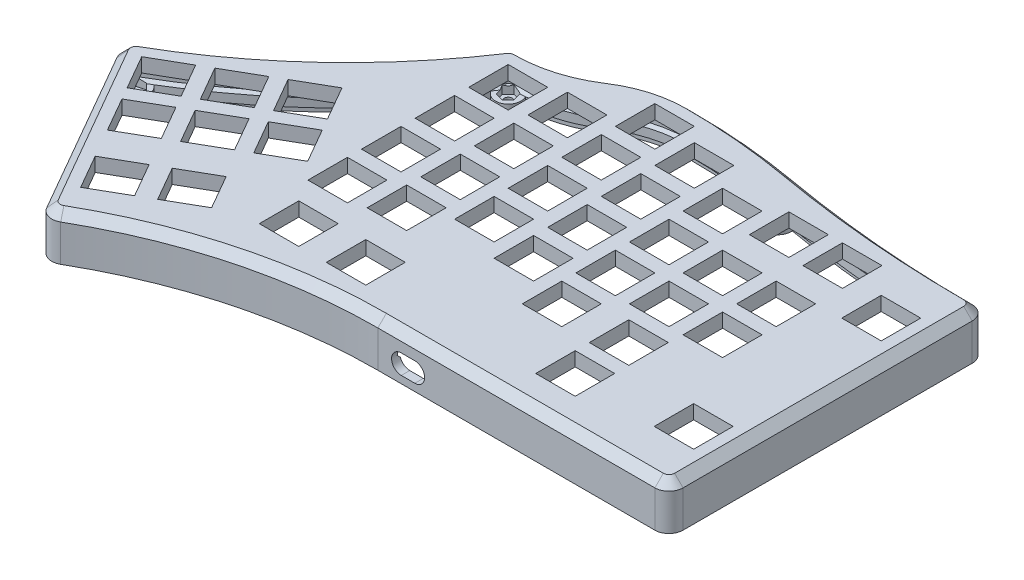
from build123d import *

# Parameters (mm, degrees)
SKETCH3_W                = 14
SKETCH3_H                = 14
MAIN_PLATE_DEPTH         = 5
MAIN_PLATE_CHAMFER_SIZE  = 3
WALL_DEPTH               = 11
NICE_NANO_RECESS_DEPTH   = 2
MAIN_SWITCH_RECESS_DEPTH = 2
SIDE_START               = -3
SIDE_DEPTH               = 3
FASTENERS_START          = -3
SKETCH8_R                = 1.35
FASTENERS_DEPTH          = 3
CHAMFER1_SIZE            = 1
NUT_SOCCETS_DEPTH        = 2
CHARGE_SOCCET_DEPTH      = 5
SKETCH11_R               = 3
MAGNET01_DEPTH           = 1.5
SKETCH10_R               = 3
MAGNET02_DEPTH           = 1.5


with BuildPart() as part:
    # Sketch3 → Main_plate (new body)
    with BuildSketch(Plane(origin=(0, 0, 0), x_dir=(1, 0, 0), z_dir=(0, 1, 0))):
        with BuildLine():
            Line((160, 22.5), (160, -80))
            ThreePointArc((160, -80), (158.535533906, -83.535533906), (155, -85))
            Line((155, -85), (56.796090657, -85))
            ThreePointArc((56.796090657, -85), (10.868246694, -91.025346783), (-31.951197412, -108.693591219))
            ThreePointArc((-31.951197412, -108.693591219), (-35.746191671, -109.186216339), (-38.77799641, -106.851088727))
            Line((-38.77799641, -106.851088727), (-72.421997828, -48.333303664))
            ThreePointArc((-72.421997828, -48.333303664), (-72.914622948, -44.538309405), (-70.579495335, -41.506504666))
            ThreePointArc((-70.579495335, -41.506504666), (-33.753261114, -14.230305993), (-4.165423102, 20.765727822))
            ThreePointArc((-4.165423102, 20.765727822), (-2.363404419, 22.406168353), (0, 23))
            ThreePointArc((0, 23), (12.260199835, 24.787186267), (23.5, 30))
            ThreePointArc((23.5, 30), (34.739800165, 35.212813733), (47, 37))
            ThreePointArc((47, 37), (66.073364447, 36.162741622), (85, 33.657407407))
            ThreePointArc((85, 33.657407407), (119.864854967, 29.042318065), (155, 27.5))
            ThreePointArc((155, 27.5), (158.535533906, 26.035533906), (160, 22.5))
        make_face()
        with Locations((104, 13.5)):
            Rectangle(SKETCH3_W, SKETCH3_H, mode=Mode.SUBTRACT)
        Polygon((-65.356627483, -46.578156408), (-53.219605396, -39.600141299), (-46.241590287, -51.737163386), (-58.378612374, -58.715178495), align=None, mode=Mode.SUBTRACT)
        with Locations((9, -10)):
            Rectangle(SKETCH3_W, SKETCH3_H, mode=Mode.SUBTRACT)
        with Locations((9, 9)):
            Rectangle(SKETCH3_W, SKETCH3_H, mode=Mode.SUBTRACT)
        with Locations((28, 11)):
            Rectangle(SKETCH3_W, SKETCH3_H, mode=Mode.SUBTRACT)
        with Locations((47, 23)):
            Rectangle(SKETCH3_W, SKETCH3_H, mode=Mode.SUBTRACT)
        with Locations((66, 18)):
            Rectangle(SKETCH3_W, SKETCH3_H, mode=Mode.SUBTRACT)
        with Locations((85, 9)):
            Rectangle(SKETCH3_W, SKETCH3_H, mode=Mode.SUBTRACT)
        with Locations((104, -10)):
            Rectangle(SKETCH3_W, SKETCH3_H, mode=Mode.SUBTRACT)
        with Locations((123, -10)):
            Rectangle(SKETCH3_W, SKETCH3_H, mode=Mode.SUBTRACT)
        with Locations((146, 4.25)):
            Rectangle(SKETCH3_W, SKETCH3_H, mode=Mode.SUBTRACT)
        with Locations((146, -62.25)):
            Rectangle(SKETCH3_W, SKETCH3_H, mode=Mode.SUBTRACT)
        with Locations((28, -8)):
            Rectangle(SKETCH3_W, SKETCH3_H, mode=Mode.SUBTRACT)
        with Locations((47, 4)):
            Rectangle(SKETCH3_W, SKETCH3_H, mode=Mode.SUBTRACT)
        with Locations((66, -1)):
            Rectangle(SKETCH3_W, SKETCH3_H, mode=Mode.SUBTRACT)
        with Locations((85, -10)):
            Rectangle(SKETCH3_W, SKETCH3_H, mode=Mode.SUBTRACT)
        with Locations((104, -29)):
            Rectangle(SKETCH3_W, SKETCH3_H, mode=Mode.SUBTRACT)
        with Locations((123, -29)):
            Rectangle(SKETCH3_W, SKETCH3_H, mode=Mode.SUBTRACT)
        with Locations((9, -29)):
            Rectangle(SKETCH3_W, SKETCH3_H, mode=Mode.SUBTRACT)
        with Locations((28, -27)):
            Rectangle(SKETCH3_W, SKETCH3_H, mode=Mode.SUBTRACT)
        with Locations((47, -15)):
            Rectangle(SKETCH3_W, SKETCH3_H, mode=Mode.SUBTRACT)
        with Locations((66, -20)):
            Rectangle(SKETCH3_W, SKETCH3_H, mode=Mode.SUBTRACT)
        with Locations((85, -29)):
            Rectangle(SKETCH3_W, SKETCH3_H, mode=Mode.SUBTRACT)
        with Locations((9, -48)):
            Rectangle(SKETCH3_W, SKETCH3_H, mode=Mode.SUBTRACT)
        with Locations((28, -46)):
            Rectangle(SKETCH3_W, SKETCH3_H, mode=Mode.SUBTRACT)
        with Locations((47, -34)):
            Rectangle(SKETCH3_W, SKETCH3_H, mode=Mode.SUBTRACT)
        with Locations((66, -39)):
            Rectangle(SKETCH3_W, SKETCH3_H, mode=Mode.SUBTRACT)
        with Locations((85, -48)):
            Rectangle(SKETCH3_W, SKETCH3_H, mode=Mode.SUBTRACT)
        with Locations((13.75, -70)):
            Rectangle(SKETCH3_W, SKETCH3_H, mode=Mode.SUBTRACT)
        with Locations((108.75, -67)):
            Rectangle(SKETCH3_W, SKETCH3_H, mode=Mode.SUBTRACT)
        Polygon((-30.91487853, -78.39526547), (-43.051900617, -85.373280579), (-36.073885508, -97.510302666), (-23.936863421, -90.532287557), align=None, mode=Mode.SUBTRACT)
        Polygon((-25.713297636, -75.404687566), (-13.576275549, -68.426672458), (-6.59826044, -80.563694545), (-18.735282527, -87.541709654), align=None, mode=Mode.SUBTRACT)
        with Locations((123, 13.5)):
            Rectangle(SKETCH3_W, SKETCH3_H, mode=Mode.SUBTRACT)
        with Locations((37.5, -70)):
            Rectangle(SKETCH3_W, SKETCH3_H, mode=Mode.SUBTRACT)
        with Locations((108.75, -48)):
            Rectangle(SKETCH3_W, SKETCH3_H, mode=Mode.SUBTRACT)
        Polygon((-55.886464121, -63.04982924), (-43.749442034, -56.071814132), (-36.771426925, -68.208836219), (-48.908449012, -75.186851327), align=None, mode=Mode.SUBTRACT)
        Polygon((-48.884954651, -37.107993046), (-36.747932564, -30.129977937), (-29.769917455, -42.267000024), (-41.906939542, -49.245015133), align=None, mode=Mode.SUBTRACT)
        Polygon((-32.413281818, -27.637829684), (-20.276259731, -20.659814575), (-13.298244622, -32.796836662), (-25.435266709, -39.774851771), align=None, mode=Mode.SUBTRACT)
        Polygon((-22.943118456, -44.109502517), (-10.806096369, -37.131487408), (-3.82808126, -49.268509495), (-15.965103347, -56.246524604), align=None, mode=Mode.SUBTRACT)
        Polygon((-39.414791289, -53.579665878), (-27.277769202, -46.60165077), (-20.299754093, -58.738672857), (-32.43677618, -65.716687966), align=None, mode=Mode.SUBTRACT)
    extrude(amount=-MAIN_PLATE_DEPTH)

    # Main_plate_chamfer
    main_plate_chamfer_edges = [part.edges().sort_by_distance(p)[0] for p in [
        (119.864854967, 0, -29.042318065),
        (158.535533906, 0, -26.035533906),
        (160, 0, 28.75),
        (158.535533906, 0, 83.535533906),
        (105.898045329, 0, 85),
        (10.868246694, 0, 91.025346783),
        (-35.746191671, 0, 109.186216339),
        (-55.599997119, 0, 77.592196196),
        (-72.914622948, 0, 44.538309405),
        (-33.753261114, 0, 14.230305993),
        (-2.363404419, 0, -22.406168353),
        (12.260199835, 0, -24.787186267),
        (34.739800165, 0, -35.212813733),
        (66.073364447, 0, -36.162741622),
    ]]
    chamfer(main_plate_chamfer_edges, length=MAIN_PLATE_CHAMFER_SIZE)

    # Sketch4 → Wall (add)
    with BuildSketch(Plane.XZ.offset(5)):
        with BuildLine():
            Line((155, 85), (56.796090657, 85))
            ThreePointArc((56.796090657, 85), (10.868246694, 91.025346783), (-31.951197412, 108.693591219))
            ThreePointArc((-31.951197412, 108.693591219), (-35.746191671, 109.186216339), (-38.77799641, 106.851088727))
            Line((-38.77799641, 106.851088727), (-72.421997828, 48.333303664))
            ThreePointArc((-72.421997828, 48.333303664), (-72.914622948, 44.538309405), (-70.579495335, 41.506504666))
            ThreePointArc((-70.579495335, 41.506504666), (-33.753261114, 14.230305993), (-4.165423102, -20.765727822))
            ThreePointArc((-4.165423102, -20.765727822), (-2.363404419, -22.406168353), (0, -23))
            ThreePointArc((0, -23), (12.260199835, -24.787186267), (23.5, -30))
            ThreePointArc((23.5, -30), (34.739800165, -35.212813733), (47, -37))
            ThreePointArc((47, -37), (66.073364447, -36.162741622), (85, -33.657407407))
            ThreePointArc((85, -33.657407407), (119.864854967, -29.042318065), (155, -27.5))
            ThreePointArc((155, -27.5), (158.535533906, -26.035533906), (160, -22.5))
            Line((160, -22.5), (160, 80))
            ThreePointArc((160, 80), (158.535533906, 83.535533906), (155, 85))
        make_face()
        with BuildLine():
            Line((-37.044136112, 105.854229426), (-70.68813753, 47.336444363))
            ThreePointArc((-70.68813753, 47.336444363), (-70.983712602, 45.059447807), (-69.582636034, 43.240364964))
            ThreePointArc((-69.582636034, 43.240364964), (-32.385273168, 15.689281312), (-2.499253861, -19.659436693))
            ThreePointArc((-2.499253861, -19.659436693), (-1.418042651, -20.643701012), (0, -21))
            ThreePointArc((0, -21), (12.831153008, -22.8704149), (24.594386694, -28.325987526))
            ThreePointArc((24.594386694, -28.325987526), (35.310753338, -33.296042365), (47, -35))
            ThreePointArc((47, -35), (65.898115208, -34.170434491), (84.650849693, -31.688119703))
            ThreePointArc((84.650849693, -31.688119703), (119.689605729, -27.050010933), (155, -25.5))
            ThreePointArc((155, -25.5), (157.121320344, -24.621320344), (158, -22.5))
            Line((158, -22.5), (158, 80))
            ThreePointArc((158, 80), (157.121320344, 82.121320344), (155, 83))
            Line((155, 83), (56.796090657, 83))
            ThreePointArc((56.796090657, 83), (10.352359398, 89.093026857), (-32.948056713, 106.959730921))
            ThreePointArc((-32.948056713, 106.959730921), (-35.225053269, 107.255305993), (-37.044136112, 105.854229426))
        make_face(mode=Mode.SUBTRACT)
    extrude(amount=WALL_DEPTH)

    # Sketch6 → Nice-nano_recess (cut)
    with BuildSketch(Plane.XZ.offset(5)):
        with BuildLine():
            Line((75.02, 78.3), (75.22, 78.3))
            ThreePointArc((75.22, 78.3), (76.209949494, 77.889949494), (76.62, 76.9))
            Line((76.62, 76.9), (76.62, 46.7))
            ThreePointArc((76.62, 46.7), (76.209949494, 45.710050506), (75.22, 45.3))
            Line((75.22, 45.3), (75.02, 45.3))
            ThreePointArc((75.02, 45.3), (74.030050506, 45.710050506), (73.62, 46.7))
            Line((73.62, 46.7), (73.62, 76.9))
            ThreePointArc((73.62, 76.9), (74.030050506, 77.889949494), (75.02, 78.3))
        make_face()
        with BuildLine():
            Line((58.38, 76.9), (58.38, 46.7))
            ThreePointArc((58.38, 46.7), (58.790050506, 45.710050506), (59.78, 45.3))
            Line((59.78, 45.3), (59.98, 45.3))
            ThreePointArc((59.98, 45.3), (60.969949494, 45.710050506), (61.38, 46.7))
            Line((61.38, 46.7), (61.38, 76.9))
            ThreePointArc((61.38, 76.9), (60.969949494, 77.889949494), (59.98, 78.3))
            Line((59.98, 78.3), (59.78, 78.3))
            ThreePointArc((59.78, 78.3), (58.790050506, 77.889949494), (58.38, 76.9))
        make_face()
    extrude(amount=-NICE_NANO_RECESS_DEPTH, mode=Mode.SUBTRACT)

    # Sketch12 → Main_switch_recess (cut)
    with BuildSketch(Plane.XZ.offset(5)):
        with BuildLine():
            Line((85.4, 78.5), (89.6, 78.5))
            ThreePointArc((89.6, 78.5), (90.589949494, 78.089949494), (91, 77.1))
            Line((91, 77.1), (91, 76.9))
            ThreePointArc((91, 76.9), (90.589949494, 75.910050506), (89.6, 75.5))
            Line((89.6, 75.5), (85.4, 75.5))
            ThreePointArc((85.4, 75.5), (84.410050506, 75.910050506), (84, 76.9))
            Line((84, 76.9), (84, 77.1))
            ThreePointArc((84, 77.1), (84.410050506, 78.089949494), (85.4, 78.5))
        make_face()
        with BuildLine():
            Line((91, 71.9), (91, 72.1))
            ThreePointArc((91, 72.1), (90.589949494, 73.089949494), (89.6, 73.5))
            Line((89.6, 73.5), (85.4, 73.5))
            ThreePointArc((85.4, 73.5), (84.410050506, 73.089949494), (84, 72.1))
            Line((84, 72.1), (84, 71.9))
            ThreePointArc((84, 71.9), (84.410050506, 70.910050506), (85.4, 70.5))
            Line((85.4, 70.5), (89.6, 70.5))
            ThreePointArc((89.6, 70.5), (90.589949494, 70.910050506), (91, 71.9))
        make_face()
    extrude(amount=-MAIN_SWITCH_RECESS_DEPTH, mode=Mode.SUBTRACT)

    # Sketch7 → Side (add)
    with BuildSketch(Plane(origin=(0, -14, 0), x_dir=(-1, 0, 0), z_dir=(0, -1, 0)).offset(SIDE_START)):
        with BuildLine():
            Line((37.044136112, -105.854229426), (70.68813753, -47.336444363))
            ThreePointArc((70.68813753, -47.336444363), (70.983712602, -45.059447807), (69.582636034, -43.240364964))
            ThreePointArc((69.582636034, -43.240364964), (32.385273168, -15.689281312), (2.499253861, 19.659436693))
            ThreePointArc((2.499253861, 19.659436693), (1.418042651, 20.643701012), (0, 21))
            ThreePointArc((0, 21), (-12.831153008, 22.8704149), (-24.594386694, 28.325987526))
            ThreePointArc((-24.594386694, 28.325987526), (-35.310753338, 33.296042365), (-47, 35))
            ThreePointArc((-47, 35), (-65.898115208, 34.170434491), (-84.650849693, 31.688119703))
            ThreePointArc((-84.650849693, 31.688119703), (-119.689605729, 27.050010933), (-155, 25.5))
            ThreePointArc((-155, 25.5), (-157.121320344, 24.621320344), (-158, 22.5))
            Line((-158, 22.5), (-158, -80))
            ThreePointArc((-158, -80), (-157.121320344, -82.121320344), (-155, -83))
            Line((-155, -83), (-56.796090657, -83))
            ThreePointArc((-56.796090657, -83), (-10.352359398, -89.093026857), (32.948056713, -106.959730921))
            ThreePointArc((32.948056713, -106.959730921), (35.225053269, -107.255305993), (37.044136112, -105.854229426))
        make_face()
        with BuildLine():
            Line((36.177205963, -105.355799775), (69.82120738, -46.838014712))
            ThreePointArc((69.82120738, -46.838014712), (70.018257429, -45.320017009), (69.084206384, -44.107295113))
            ThreePointArc((69.084206384, -44.107295113), (31.701279195, -16.418768971), (1.666169241, 19.106291129))
            ThreePointArc((1.666169241, 19.106291129), (0.945361767, 19.762467341), (0, 20))
            ThreePointArc((0, 20), (-13.116629595, 21.912029217), (-25.141580042, 27.488981289))
            ThreePointArc((-25.141580042, 27.488981289), (-35.596229925, 32.337656682), (-47, 34))
            ThreePointArc((-47, 34), (-65.810490589, 33.174280926), (-84.476274539, 30.703475851))
            ThreePointArc((-84.476274539, 30.703475851), (-119.601981109, 26.053857368), (-155, 24.5))
            ThreePointArc((-155, 24.5), (-156.414213562, 23.914213562), (-157, 22.5))
            Line((-157, 22.5), (-157, -80))
            ThreePointArc((-157, -80), (-156.414213562, -81.414213562), (-155, -82))
            Line((-155, -82), (-56.796090657, -82))
            ThreePointArc((-56.796090657, -82), (-10.094415751, -88.126866893), (33.446486364, -106.092800772))
            ThreePointArc((33.446486364, -106.092800772), (34.964484067, -106.28985082), (36.177205963, -105.355799775))
        make_face(mode=Mode.SUBTRACT)
    extrude(amount=SIDE_DEPTH)

    # Sketch8 → Fasteners (add)
    # profile 1 of 7: a face of its own
    with BuildSketch(Plane.XZ.offset(14).offset(FASTENERS_START)):
        with BuildLine():
            Line((158, 80), (158, 76.645898034))
            ThreePointArc((158, 76.645898034), (151.818019485, 76.818019485), (151.645898034, 83))
            Line((151.645898034, 83), (155, 83))
            ThreePointArc((155, 83), (157.121320344, 82.121320344), (158, 80))
        make_face()
        with Locations(Location((155, 80, 0), (0, 0, 270))):
            Circle(SKETCH8_R, mode=Mode.SUBTRACT)
    # profile 2 of 7: a face of its own
    with BuildSketch(Plane.XZ.offset(14).offset(FASTENERS_START)):
        with BuildLine():
            Line((158, -19.145898034), (158, -22.5))
            ThreePointArc((158, -22.5), (157.121320344, -24.621320344), (155, -25.5))
            Line((155, -25.5), (151.658342551, -25.513855586))
            ThreePointArc((151.658342551, -25.513855586), (151.811441815, -19.32461078), (158, -19.145898034))
        make_face()
        with Locations(Location((155, -22.5, 0), (0, 0, 270))):
            Circle(SKETCH8_R, mode=Mode.SUBTRACT)
    # profile 3 of 7: a face of its own
    with BuildSketch(Plane.XZ.offset(14).offset(FASTENERS_START)):
        with BuildLine():
            Line((0, -21), (3.245354491, -21.117318436))
            ThreePointArc((3.245354491, -21.117318436), (2.180948008, -14.063825996), (-4.363800284, -16.90125204))
            Line((-4.363800284, -16.90125204), (-2.499253861, -19.659436693))
            ThreePointArc((-2.499253861, -19.659436693), (-1.418042651, -20.643701012), (0, -21))
        make_face()
        with Locations(Location((0, -18, 0), (0, 0, 270))):
            Circle(SKETCH8_R, mode=Mode.SUBTRACT)
    # profile 4 of 7: a face of its own
    with BuildSketch(Plane.XZ.offset(14).offset(FASTENERS_START)):
        with BuildLine():
            Line((-69.016353658, 50.244216481), (-70.68813753, 47.336444363))
            ThreePointArc((-70.68813753, 47.336444363), (-70.983712602, 45.059447807), (-69.582636034, 43.240364964))
            Line((-69.582636034, 43.240364964), (-66.710261221, 41.557041205))
            ThreePointArc((-66.710261221, 41.557041205), (-63.737985367, 46.995734413), (-69.016353658, 50.244216481))
        make_face()
        with Locations(Location((-68.087347082, 45.841155411, 0), (0, 0, 270))):
            Circle(SKETCH8_R, mode=Mode.SUBTRACT)
    # profile 5 of 7: a face of its own
    with BuildSketch(Plane.XZ.offset(14).offset(FASTENERS_START)):
        with BuildLine():
            Line((-37.044136112, 105.854229426), (-38.715919983, 102.946457308))
            ThreePointArc((-38.715919983, 102.946457308), (-33.250812903, 100.019831624), (-30.049017184, 105.328413117))
            Line((-30.049017184, 105.328413117), (-32.948056713, 106.959730921))
            ThreePointArc((-32.948056713, 106.959730921), (-35.225053269, 107.255305993), (-37.044136112, 105.854229426))
        make_face()
        with Locations(Location((-34.443345665, 104.358940474, 0), (0, 0, 270))):
            Circle(SKETCH8_R, mode=Mode.SUBTRACT)
    # profile 6 of 7: a face of its own
    with BuildSketch(Plane.XZ.offset(14).offset(FASTENERS_START)):
        with BuildLine():
            Line((82.019307, -32.137905063), (88.933372526, -30.952630374))
            ThreePointArc((88.933372526, -30.952630374), (84.239658898, -24.33133443), (82.019307, -32.137905063))
        make_face()
        with Locations(Location((85, -28.766633902, 0), (0, 0, 270))):
            Circle(SKETCH8_R, mode=Mode.SUBTRACT)
    # profile 7 of 7: a face of its own
    with BuildSketch(Plane.XZ.offset(14).offset(FASTENERS_START)):
        with BuildLine():
            ThreePointArc((45.805732077, 83.335734949), (48.808349185, 75.670172441), (52.452419754, 83.052401626))
            ThreePointArc((52.452419754, 83.052401626), (49.12776721, 83.163367496), (45.805732077, 83.335734949))
        make_face()
        with Locations(Location((49, 80.166089474, 0), (0, 0, 270))):
            Circle(SKETCH8_R, mode=Mode.SUBTRACT)
    extrude(amount=FASTENERS_DEPTH)

    # Chamfer1
    chamfer1_edges = [part.edges().sort_by_distance(p)[0] for p in [
        (119.689605729, -11, -27.050010933),
        (12.831153008, -11, -22.8704149),
        (-1.418042651, -11, -20.643701012),
        (-32.385273168, -11, 15.689281312),
        (-70.983712602, -11, 45.059447807),
        (-53.866136821, -11, 76.595336894),
        (-35.225053269, -11, 107.255305993),
        (10.352359398, -11, 89.093026857),
        (105.898045329, -11, 83),
        (157.121320344, -11, 82.121320344),
        (158, -11, 28.75),
        (65.898115208, -11, -34.170434491),
        (35.310753338, -11, -33.296042365),
    ]]
    chamfer(chamfer1_edges, length=CHAMFER1_SIZE - 0.0001)  # a hair under: the kernel refuses the full size

    # Sketch9 → Nut_soccets (cut, symmetric)
    with BuildSketch(Plane(origin=(0, -11, 0), x_dir=(1, 0, 0), z_dir=(0, 1, 0))):
        Polygon((-65.188167162, -45.069951295), (-67.305639478, -42.944789892), (-70.204819399, -43.715994008), (-70.986527003, -46.612359528), (-68.869054686, -48.737520931), (-65.969874766, -47.966316814), align=None)
        Polygon((-32.943345665, -101.760864262), (-35.943345665, -101.760864262), (-37.443345665, -104.358940474), (-35.943345665, -106.957016685), (-32.943345665, -106.957016685), (-31.443345665, -104.358940474), align=None)
        Polygon((51.531835304, -78.556800814), (48.87223279, -77.168811452), (46.340397486, -78.778100113), (46.468164696, -81.775378135), (49.12776721, -83.163367496), (51.659602514, -81.554078835), align=None)
        Polygon((153.5, -77.401923789), (152, -80), (153.5, -82.598076211), (156.5, -82.598076211), (158, -80), (156.5, -77.401923789), align=None)
        Polygon((2.897777479, 17.223542865), (2.121320344, 20.121320344), (-0.776457135, 20.897777479), (-2.897777479, 18.776457135), (-2.121320344, 15.878679656), (0.776457135, 15.102222521), align=None)
        Polygon((86.5, 26.168557691), (88, 28.766633902), (86.5, 31.364710114), (83.5, 31.364710114), (82, 28.766633902), (83.5, 26.168557691), align=None)
        Polygon((153.5, 19.901923789), (156.5, 19.901923789), (158, 22.5), (156.5, 25.098076211), (153.5, 25.098076211), (152, 22.5), align=None)
    extrude(amount=NUT_SOCCETS_DEPTH, both=True, mode=Mode.SUBTRACT)

    # Sketch5 → Charge_soccet (cut, symmetric)
    with BuildSketch(Plane.XY.offset(85)):
        with BuildLine():
            Line((65.1, -6.53), (69.9, -6.53))
            ThreePointArc((69.9, -6.53), (73.35, -9.98), (69.9, -13.43))
            Line((69.9, -13.43), (65.1, -13.43))
            ThreePointArc((65.1, -13.43), (61.65, -9.98), (65.1, -6.53))
        make_face()
    extrude(amount=CHARGE_SOCCET_DEPTH, both=True, mode=Mode.SUBTRACT)

    # Sketch11 → Magnet01 (cut)
    with BuildSketch(Plane(origin=(37.533909435, 0, 65.283591498), x_dir=(-0.8669301490733572, 0, 0.49842965063050443), z_dir=(-0.49842965063050443, 0, -0.8669301490733572))):
        with Locations((71.875565032, -8)):
            Circle(SKETCH11_R)
    extrude(amount=-MAGNET01_DEPTH, mode=Mode.SUBTRACT)

    # Sketch10 → Magnet02 (cut)
    with BuildSketch(Plane.XY.offset(82)):
        with Locations(Location((145, -8, 0), (0, 0, 221.810314896))):
            Circle(SKETCH10_R)
    extrude(amount=MAGNET02_DEPTH, mode=Mode.SUBTRACT)


solid = part.part
